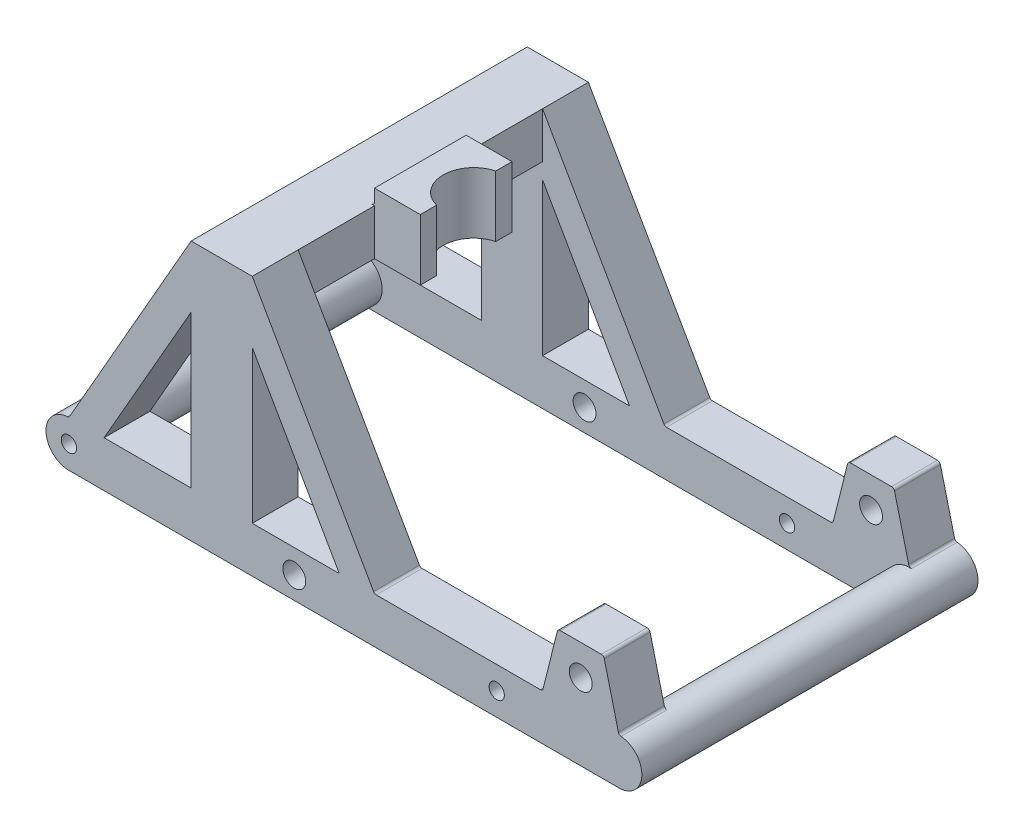
from build123d import *

# Parameters (mm, degrees)
BOSS_EXTRUDE1_DEPTH = 38.1
SKETCH2_R           = 19.05
BOSS_EXTRUDE2_DEPTH = 203.2
SKETCH4_W           = 254
SKETCH4_H           = 38.1
BOSS_EXTRUDE3_DEPTH = 177.8
CUT_EXTRUDE3_DEPTH  = 38.1
SKETCH8_R           = 6.35
CUT_EXTRUDE4_DEPTH  = 432.286091243
BOSS_EXTRUDE4_REACH = 409.638
SKETCH9_W           = 50.8
SKETCH9_H           = 38.1
BOSS_EXTRUDE5_DEPTH = 50.8
SKETCH13_W          = 63.5
SKETCH13_H          = 38.1
BOSS_EXTRUDE6_DEPTH = 50.8
CUT_EXTRUDE7_DEPTH  = 438.78172929
FILLET1_R           = 2.54
SKETCH12_R          = 9.525
CUT_EXTRUDE5_DEPTH  = 438.78172929


with BuildPart() as part:
    # Sketch1 → Boss-Extrude1 (new body)
    with BuildSketch(Plane.XY):
        with BuildLine():
            Line((228.6, 38.1), (-228.6, 38.1))
            ThreePointArc((-228.6, 38.1), (-247.65, 19.05), (-228.6, 0))
            Line((-228.6, 0), (228.6, 0))
            ThreePointArc((228.6, 0), (247.65, 19.05), (228.6, 38.1))
        make_face()
    boss_extrude1 = extrude(amount=BOSS_EXTRUDE1_DEPTH)

    # Sketch2 → Boss-Extrude2 (add)
    with BuildSketch(Plane.XY.offset(38.1)):
        with Locations((-228.6, 19.05)):
            Circle(SKETCH2_R)
        with Locations((228.6, 19.05)):
            Circle(SKETCH2_R)
    boss_extrude2 = extrude(amount=BOSS_EXTRUDE2_DEPTH)

    # Mirror3: Boss-Extrude1, Boss-Extrude2 across plane
    add(boss_extrude1.mirror(Plane.XY.offset(139.7)))
    add(boss_extrude2.mirror(Plane.XY.offset(139.7)))

    # Sketch4 → Boss-Extrude3 (add)
    with BuildSketch(Plane(origin=(0, 38.1, 0), x_dir=(1, 0, 0), z_dir=(0, 1, 0))):
        with Locations((-101.6, -260.35)):
            Rectangle(SKETCH4_W, SKETCH4_H)
    boss_extrude3 = extrude(amount=BOSS_EXTRUDE3_DEPTH)

    # Sketch7 → Cut-Extrude3 (cut)
    with BuildSketch(Plane.XY.offset(279.4)):
        Polygon((-228.6, 38.1), (-127, 215.9), (-228.6, 215.9), align=None)
        Polygon((-76.2, 215.9), (25.4, 38.1), (25.4, 215.9), align=None)
        Polygon((-127, 164.704663298), (-199.345521885, 38.1), (-127, 38.1), align=None)
        Polygon((-76.2, 164.704663298), (-76.2, 38.1), (-3.854478115, 38.1), align=None)
    cut_extrude3 = extrude(amount=-CUT_EXTRUDE3_DEPTH, mode=Mode.SUBTRACT)

    # Mirror4: Boss-Extrude3, Cut-Extrude3 across plane
    add(boss_extrude3.mirror(Plane.XY.offset(139.7)))
    add(cut_extrude3.mirror(Plane.XY.offset(139.7)), mode=Mode.SUBTRACT)

    # Sketch8 → Cut-Extrude4 (cut, through all)
    with BuildSketch(Plane.XY.offset(279.4)):
        with Locations((-228.6, 19.05)):
            Circle(SKETCH8_R)
        with Locations((127, 19.05)):
            Circle(SKETCH8_R)
    extrude(amount=-CUT_EXTRUDE4_DEPTH, mode=Mode.SUBTRACT)

    # Sketch9 → Boss-Extrude4 (add, up to next)
    with BuildSketch(Plane(origin=(0, 0, 241.3), x_dir=(-1, 0, 0), z_dir=(0, 0, -1)), mode=Mode.PRIVATE) as boss_extrude4_sk1:
        with Locations((101.6, 196.85)):
            Rectangle(SKETCH9_W, SKETCH9_H)
    boss_extrude4_tool1 = extrude(boss_extrude4_sk1.sketch, amount=BOSS_EXTRUDE4_REACH, mode=Mode.PRIVATE) - part.part
    add(boss_extrude4_tool1.solids().sort_by_distance((-101.6, 196.85, 241.3))[0])

    # Sketch10 → Boss-Extrude5 (add)
    with BuildSketch(Plane.XZ.offset(-177.8)):
        with BuildLine():
            Line((-76.2, 177.8), (-38.1, 177.8))
            Line((-38.1, 177.8), (-38.1, 164.293444248))
            ThreePointArc((-38.1, 164.293444248), (-57.15, 139.7), (-38.1, 115.106555752))
            Line((-38.1, 115.106555752), (-38.1, 101.6))
            Line((-38.1, 101.6), (-76.2, 101.6))
            Line((-76.2, 101.6), (-76.2, 177.8))
        make_face()
    extrude(amount=-BOSS_EXTRUDE5_DEPTH)

    # Sketch13 → Boss-Extrude6 (add)
    with BuildSketch(Plane(origin=(0, 38.1, 0), x_dir=(1, 0, 0), z_dir=(0, 1, 0))):
        with Locations((196.85, -260.35)):
            Rectangle(SKETCH13_W, SKETCH13_H)
        with Locations((196.85, -19.05)):
            Rectangle(SKETCH13_W, SKETCH13_H)
    extrude(amount=BOSS_EXTRUDE6_DEPTH)

    # Sketch14 → Cut-Extrude7 (cut, through all)
    with BuildSketch(Plane(origin=(0, 0, 0), x_dir=(-1, 0, 0), z_dir=(0, 0, -1))):
        Polygon((-177.8, 88.9), (-165.1, 38.1), (-165.1, 88.9), align=None)
        Polygon((-228.6, 38.1), (-215.9, 88.9), (-228.6, 88.9), align=None)
    extrude(amount=-CUT_EXTRUDE7_DEPTH, mode=Mode.SUBTRACT)

    # Fillet1
    fillet1_edges = [part.edges().sort_by_distance(p)[0] for p in [
        (-76.2, 215.9, 139.7),
        (25.4, 38.1, 260.35),
        (25.4, 38.1, 19.05),
        (-228.6, 38.1, 260.35),
        (-228.6, 38.1, 19.05),
        (215.9, 88.9, 260.35),
        (177.8, 88.9, 260.35),
        (165.1, 38.1, 19.05),
        (165.1, 38.1, 260.35),
        (177.8, 88.9, 19.05),
        (215.9, 88.9, 19.05),
        (228.6, 38.1, 19.05),
        (228.6, 38.1, 260.35),
    ]]
    fillet(fillet1_edges, radius=FILLET1_R)

    # Sketch12 → Cut-Extrude5 (cut, through all)
    with BuildSketch(Plane(origin=(0, 0, 0), x_dir=(-1, 0, 0), z_dir=(0, 0, -1))):
        with Locations((41.275, 18.386071678)):
            Circle(SKETCH12_R)
        with Locations((-196.85, 63.5)):
            Circle(SKETCH12_R)
    extrude(amount=-CUT_EXTRUDE5_DEPTH, mode=Mode.SUBTRACT)


solid = part.part
